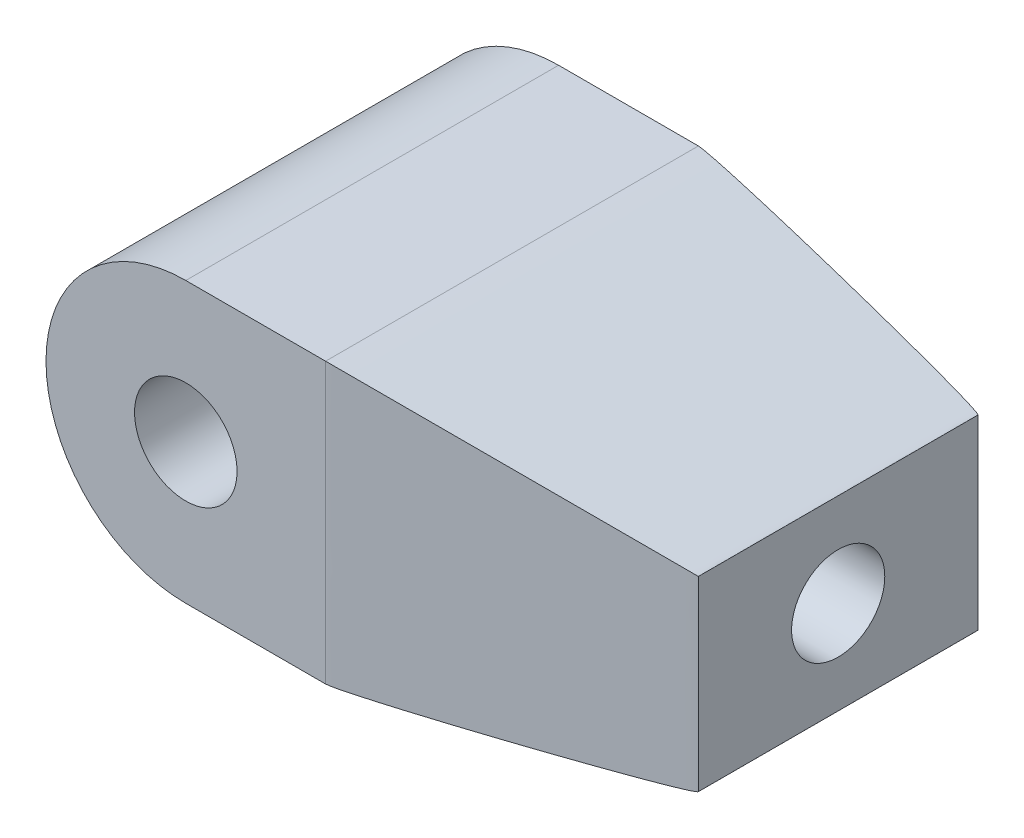
from build123d import *

# Parameters (mm, degrees)
SKETCH_1_W          = 13
SKETCH_1_H          = 8
EXTRUDE_1_DEPTH     = 6
SKETCH_2_R          = 1.1
CUT_EXTRUDE_1_DEPTH = 17.401219467
SKETCH_3_R          = 1
CUT_EXTRUDE_2_DEPTH = 8
FILLET_1_SIZE       = 1
FILLET_1_SIZE_2     = 7
FILLET_2_R          = 3


# Some blends are built 0.0001 mm under size
with BuildPart() as part:
    # 草图1 → 凸台-拉伸1 (new body)
    with BuildSketch(Plane(origin=(0, 0, 0), x_dir=(1, 0, 0), z_dir=(0, 1, 0))):
        with Locations((6.5, 4)):
            Rectangle(SKETCH_1_W, SKETCH_1_H)
    extrude(amount=EXTRUDE_1_DEPTH)

    # 草图2 → 切除-拉伸1 (cut, through all)
    with BuildSketch(Plane.XY):
        with Locations((3, 3)):
            Circle(SKETCH_2_R)
    extrude(amount=-CUT_EXTRUDE_1_DEPTH, mode=Mode.SUBTRACT)

    # 草图3 → 切除-拉伸2 (cut)
    with BuildSketch(Plane(origin=(13, 0, 0), x_dir=(0, 0, -1), z_dir=(1, 0, 0))):
        with Locations((4, 3)):
            Circle(SKETCH_3_R)
    extrude(amount=-CUT_EXTRUDE_2_DEPTH, mode=Mode.SUBTRACT)

    # 圆角1
    # a fillet whose section is not a circle: 7, 1 mm, written as the material it takes off along each edge
    with BuildSketch(Plane(origin=(13, -17.5, -8), x_dir=(0, 0, 1), z_dir=(0, 1, 0))) as fillet_1_piece_1:
        with BuildLine():
            Bezier((FILLET_1_SIZE, 0), (0, 0), (0, -FILLET_1_SIZE_2), weights=[1, 0.052631579, 1])
            Line((0, -FILLET_1_SIZE_2), (0, 0))
            Line((0, 0), (FILLET_1_SIZE, 0))
        make_face()
    extrude(amount=41, mode=Mode.SUBTRACT)
    with BuildSketch(Plane(origin=(13, 0, 17.5), x_dir=(-1, 0, 0), z_dir=(0, 0, -1))) as fillet_1_piece_2:
        with BuildLine():
            Bezier((FILLET_1_SIZE_2, 0), (0, 0), (0, FILLET_1_SIZE), weights=[1, 0.052631579, 1])
            Line((0, FILLET_1_SIZE), (0, 0))
            Line((0, 0), (FILLET_1_SIZE_2, 0))
        make_face()
    extrude(amount=43, mode=Mode.SUBTRACT)
    with BuildSketch(Plane(origin=(13, -17.5, 0), x_dir=(-1, 0, 0), z_dir=(0, 1, 0))) as fillet_1_piece_3:
        with BuildLine():
            Bezier((FILLET_1_SIZE_2, 0), (0, 0), (0, -FILLET_1_SIZE), weights=[1, 0.052631579, 1])
            Line((0, -FILLET_1_SIZE), (0, 0))
            Line((0, 0), (FILLET_1_SIZE_2, 0))
        make_face()
    extrude(amount=41, mode=Mode.SUBTRACT)
    with BuildSketch(Plane(origin=(13, 6, 17.5), x_dir=(-1, 0, 0), z_dir=(0, 0, -1))) as fillet_1_piece_4:
        with BuildLine():
            Bezier((FILLET_1_SIZE_2, 0), (0, 0), (0, -FILLET_1_SIZE), weights=[1, 0.052631579, 1])
            Line((0, -FILLET_1_SIZE), (0, 0))
            Line((0, 0), (FILLET_1_SIZE_2, 0))
        make_face()
    extrude(amount=43, mode=Mode.SUBTRACT)

    # 圆角2
    fillet_2_edges = [part.edges().sort_by_distance(p)[0] for p in [
        (0, 0, -4),
        (0, 6, -4),
    ]]
    fillet(fillet_2_edges, radius=FILLET_2_R - 0.0001)  # a hair under: the kernel refuses the full size


solid = part.part
